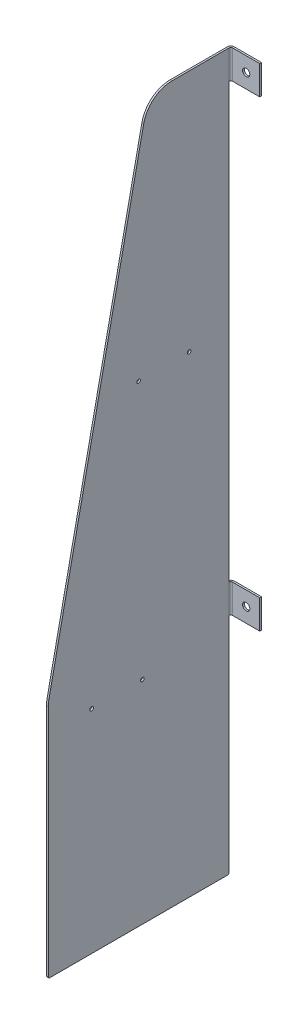
from build123d import *

# Parameters (mm, degrees)
BOSS_EXTRUDE2_DEPTH        = 3.175
SKETCH2_W                  = 3.175
SKETCH2_H                  = 50.8
BOSS_EXTRUDE3_DEPTH        = 50.8
FILLET1_R                  = 3.175
FILLET2_R                  = 6.35
F_1_2_0_5_DIAMETER_HOLE1_D = 12.7
SKETCH5_W                  = 3.175
SKETCH5_H                  = 317.5
BOSS_EXTRUDE4_DEPTH        = 342.9
FILLET3_R                  = 2.54


with BuildPart() as part:
    # Sketch1 → Boss-Extrude2 (new body)
    with BuildSketch(Plane(origin=(0, 0, 0), x_dir=(0, 0, -1), z_dir=(1, 0, 0))):
        with BuildLine():
            Line((-317.5, 0), (0, 0))
            Line((0, 0), (0, 50.8))
            Line((0, 50.8), (6.35, 50.8))
            Line((6.35, 50.8), (6.35, 101.6))
            Line((6.35, 101.6), (0, 101.6))
            Line((0, 101.6), (0, 559.756235294))
            Line((0, 559.756235294), (0, 863.6))
            Line((0, 863.6), (6.35, 863.6))
            Line((6.35, 863.6), (6.35, 914.4))
            Line((6.35, 914.4), (-100.150182785, 914.4))
            ThreePointArc((-100.150182785, 914.4), (-132.16586597, 903.041552077), (-149.864680249, 874.045513001))
            Line((-149.864680249, 874.045513001), (-316.414497465, 81.366353538))
            ThreePointArc((-316.414497465, 81.366353538), (-317.227895618, 76.171722787), (-317.5, 70.920840537))
            Line((-317.5, 70.920840537), (-317.5, 0))
        make_face()
        with BuildLine():
            ThreePointArc((-244.475, 29.604131036), (-241.3, 32.779131036), (-238.125, 29.604131036))
            ThreePointArc((-238.125, 29.604131036), (-241.3, 26.429131036), (-244.475, 29.604131036))
        make_face(mode=Mode.SUBTRACT)
        with BuildLine():
            ThreePointArc((-149.225, 29.604131036), (-152.4, 26.429131036), (-155.575, 29.604131036))
            ThreePointArc((-155.575, 29.604131036), (-152.4, 32.779131036), (-149.225, 29.604131036))
        make_face(mode=Mode.SUBTRACT)
        with BuildLine():
            ThreePointArc((-161.925, 486.804131036), (-158.75, 489.979131036), (-155.575, 486.804131036))
            ThreePointArc((-155.575, 486.804131036), (-158.75, 483.629131036), (-161.925, 486.804131036))
        make_face(mode=Mode.SUBTRACT)
        with BuildLine():
            ThreePointArc((-66.675, 486.804131036), (-69.85, 483.629131036), (-73.025, 486.804131036))
            ThreePointArc((-73.025, 486.804131036), (-69.85, 489.979131036), (-66.675, 486.804131036))
        make_face(mode=Mode.SUBTRACT)
    extrude(amount=BOSS_EXTRUDE2_DEPTH)

    # Sketch2 → Boss-Extrude3 (add)
    with BuildSketch(Plane(origin=(3.175, 0, 0), x_dir=(0, 0, -1), z_dir=(1, 0, 0))):
        with Locations((4.7625, 889)):
            Rectangle(SKETCH2_W, SKETCH2_H)
        with Locations((4.7625, 76.2)):
            Rectangle(SKETCH2_W, SKETCH2_H)
    extrude(amount=BOSS_EXTRUDE3_DEPTH)

    # Fillet1
    fillet1_edges = [part.edges().sort_by_distance(p)[0] for p in [
        (3.175, 889, -3.175),
        (3.175, 76.2, -3.175),
    ]]
    fillet(fillet1_edges, radius=FILLET1_R)

    # Fillet2
    fillet2_edges = [part.edges().sort_by_distance(p)[0] for p in [
        (0, 76.2, -6.35),
        (0, 889, -6.35),
    ]]
    fillet(fillet2_edges, radius=FILLET2_R)

    # 1/2 (0.5) Diameter Hole1 (through all)
    with Locations(Plane.XY.offset(-3.175)):
        with Locations((30.1625, 76.2), (30.1625, 889)):
            Hole(F_1_2_0_5_DIAMETER_HOLE1_D / 2)

    # Sketch5 → Boss-Extrude4 (add)
    with BuildSketch(Plane.XZ):
        with Locations((1.5875, 158.75)):
            Rectangle(SKETCH5_W, SKETCH5_H)
    extrude(amount=BOSS_EXTRUDE4_DEPTH)

    # Fillet3
    fillet3_edges = [part.edges().sort_by_distance(p)[0] for p in [
        (1.5875, -342.9, 0),
        (1.5875, -342.9, 317.5),
    ]]
    fillet(fillet3_edges, radius=FILLET3_R)


solid = part.part
